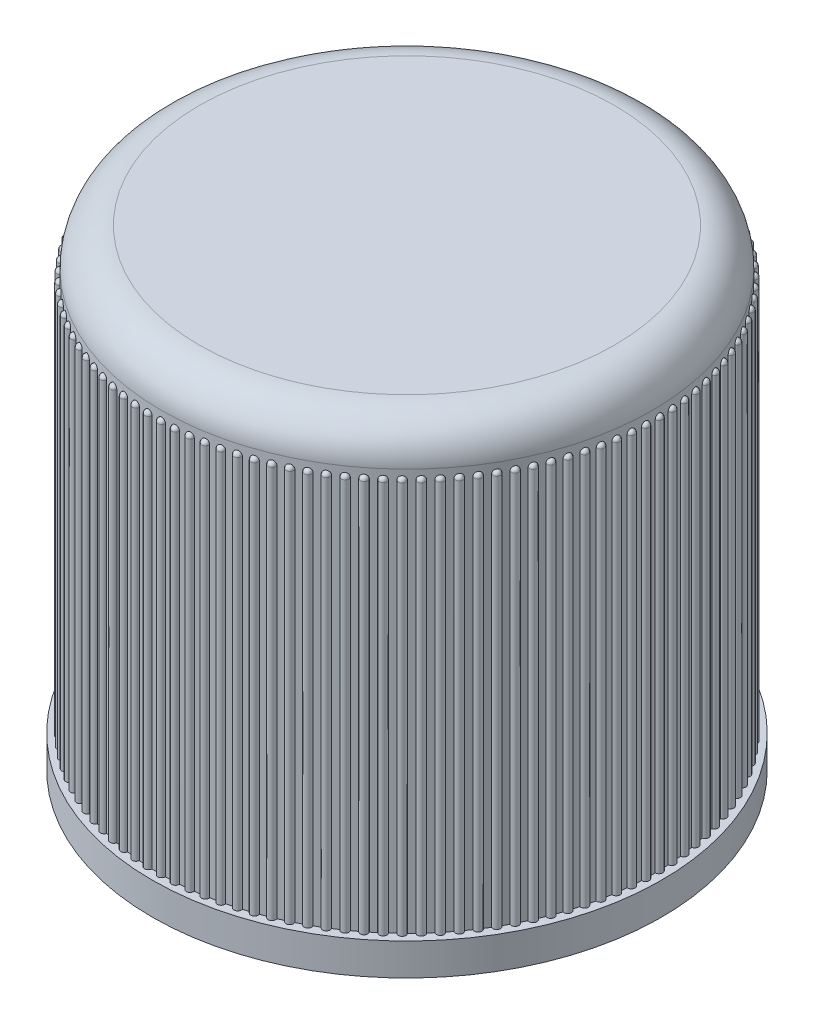
from build123d import *

# Parameters (mm, degrees)
SKETCH1_R                = 13.5
BOSS_EXTRUDE1_DEPTH      = 25
CUT_EXTRUDE1_START       = -23.3
SKETCH2_R                = 13.5
SKETCH2_R_2              = 13
CUT_EXTRUDE1_DEPTH       = 23.3
FILLET1_R                = 2
SHELL1_T                 = -0.5
BOSS_EXTRUDE3_START      = 1.2
SKETCH6_R                = 13.5
SKETCH6_R_2              = 12.5
BOSS_EXTRUDE3_DEPTH      = 1.2
SKETCH3_R                = 0.2
BOSS_EXTRUDE2_DEPTH      = 21
FILLET2_R                = 0.2
CIRPATTERN1_COUNT        = 114
FILLET2_OF_CIRPATTERN1_R = 0.2


with BuildPart() as part:
    # Sketch1 → Boss-Extrude1 (new body)
    with BuildSketch(Plane(origin=(0, 0, 0), x_dir=(1, 0, 0), z_dir=(0, 1, 0))):
        with Locations(Location((0, 0, 0), (0, 0, 270))):
            Circle(SKETCH1_R)
    extrude(amount=BOSS_EXTRUDE1_DEPTH)

    # Sketch2 → Cut-Extrude1 (cut)
    with BuildSketch(Plane(origin=(0, 25, 0), x_dir=(1, 0, 0), z_dir=(0, 1, 0)).offset(CUT_EXTRUDE1_START)):
        with Locations(Location((0, 0, 0), (0, 0, 270))):
            Circle(SKETCH2_R)
        with Locations(Location((0, 0, 0), (0, 0, 270))):
            Circle(SKETCH2_R_2, mode=Mode.SUBTRACT)
    extrude(amount=CUT_EXTRUDE1_DEPTH, mode=Mode.SUBTRACT)

    # Fillet1
    fillet1_edges = [part.edges().sort_by_distance(p)[0] for p in [
        (0, 25, -13),
    ]]
    fillet(fillet1_edges, radius=FILLET1_R)

    # Shell1
    shell1_openings = [part.faces().sort_by_distance(p)[0] for p in [
        (0, 0, 0),
    ]]
    offset(amount=SHELL1_T, openings=shell1_openings, kind=Kind.INTERSECTION)

    # Sketch6 → Boss-Extrude3 (add)
    with BuildSketch(Plane.XZ.offset(-1.2).offset(BOSS_EXTRUDE3_START)):
        with Locations(Location((0, 0, 0), (0, 0, 90))):
            Circle(SKETCH6_R)
        with Locations(Location((0, 0, 0), (0, 0, 90))):
            Circle(SKETCH6_R_2, mode=Mode.SUBTRACT)
    extrude(amount=-BOSS_EXTRUDE3_DEPTH)

    # Sketch3 → Boss-Extrude2 (add)
    with BuildSketch(Plane(origin=(0, 1.7, 0), x_dir=(1, 0, 0), z_dir=(0, 1, 0))):
        with Locations((0, -13)):
            Circle(SKETCH3_R)
    boss_extrude2 = extrude(amount=BOSS_EXTRUDE2_DEPTH)

    # Fillet2
    fillet2_edges = [part.edges().sort_by_distance(p)[0] for p in [
        (0, 22.7, 13.2),
    ]]
    fillet(fillet2_edges, radius=FILLET2_R - 0.0001)  # a hair under: the kernel refuses the full size

    # CirPattern1: Boss-Extrude2 ×114 about axis
    cirpattern1_axis = Axis((0, 0, 0), (0, 1, 0))
    for i in range(1, CIRPATTERN1_COUNT):
        add(boss_extrude2.rotate(cirpattern1_axis, i * 360 / CIRPATTERN1_COUNT))

    # Fillet2 of CirPattern1
    fillet2_of_cirpattern1_edges = [part.edges().sort_by_distance(p)[0] for p in [
        (0.727158437, 22.7, 13.179956017),
        (1.452108517, 22.7, 13.119884941),
        (2.172648592, 22.7, 13.019969205),
        (2.886590404, 22.7, 12.880512251),
        (3.591765736, 22.7, 12.701937604),
        (4.286032994, 22.7, 12.48478759),
        (4.96728371, 22.7, 12.229721687),
        (5.633448949, 22.7, 11.937514521),
        (6.282505588, 22.7, 11.609053516),
        (6.912482465, 22.7, 11.245336197),
        (7.521466359, 22.7, 10.847467161),
        (8.107607808, 22.7, 10.416654724),
        (8.669126717, 22.7, 9.954207249),
        (9.204317774, 22.7, 9.461529174),
        (9.711555621, 22.7, 8.940116745),
        (10.189299792, 22.7, 8.391553476),
        (10.636099395, 22.7, 7.817505335),
        (11.050597513, 22.7, 7.219715687),
        (11.43153533, 22.7, 6.6),
        (11.77775595, 22.7, 5.96024033),
        (12.088207912, 22.7, 5.302379605),
        (12.361948384, 22.7, 4.628415729),
        (12.598146025, 22.7, 3.940395505),
        (12.79608351, 22.7, 3.24040843),
        (12.955159711, 22.7, 2.530580341),
        (13.074891517, 22.7, 1.813066963),
        (13.154915308, 22.7, 1.09004736),
        (13.194988053, 22.7, 0.363717319),
        (13.194988053, 22.7, -0.363717319),
        (13.154915308, 22.7, -1.09004736),
        (13.074891517, 22.7, -1.813066963),
        (12.955159711, 22.7, -2.530580341),
        (12.79608351, 22.7, -3.24040843),
        (12.598146025, 22.7, -3.940395505),
        (12.361948384, 22.7, -4.628415729),
        (12.088207912, 22.7, -5.302379605),
        (11.77775595, 22.7, -5.96024033),
        (11.43153533, 22.7, -6.6),
        (11.050597513, 22.7, -7.219715687),
        (10.636099395, 22.7, -7.817505335),
        (10.189299792, 22.7, -8.391553476),
        (9.711555621, 22.7, -8.940116745),
        (9.204317774, 22.7, -9.461529174),
        (8.669126717, 22.7, -9.954207249),
        (8.107607808, 22.7, -10.416654724),
        (7.521466359, 22.7, -10.847467161),
        (6.912482465, 22.7, -11.245336197),
        (6.282505588, 22.7, -11.609053516),
        (5.633448949, 22.7, -11.937514521),
        (4.96728371, 22.7, -12.229721687),
        (4.286032994, 22.7, -12.48478759),
        (3.591765736, 22.7, -12.701937604),
        (2.886590404, 22.7, -12.880512251),
        (2.172648592, 22.7, -13.019969205),
        (1.452108517, 22.7, -13.119884941),
        (0.727158437, 22.7, -13.179956017),
        (0, 22.7, -13.2),
        (-0.727158437, 22.7, -13.179956017),
        (-1.452108517, 22.7, -13.119884941),
        (-2.172648592, 22.7, -13.019969205),
        (-2.886590404, 22.7, -12.880512251),
        (-3.591765736, 22.7, -12.701937604),
        (-4.286032994, 22.7, -12.48478759),
        (-4.96728371, 22.7, -12.229721687),
        (-5.633448949, 22.7, -11.937514521),
        (-6.282505588, 22.7, -11.609053516),
        (-6.912482465, 22.7, -11.245336197),
        (-7.521466359, 22.7, -10.847467161),
        (-8.107607808, 22.7, -10.416654724),
        (-8.669126717, 22.7, -9.954207249),
        (-9.204317774, 22.7, -9.461529174),
        (-9.711555621, 22.7, -8.940116745),
        (-10.189299792, 22.7, -8.391553476),
        (-10.636099395, 22.7, -7.817505335),
        (-11.050597513, 22.7, -7.219715687),
        (-11.43153533, 22.7, -6.6),
        (-11.77775595, 22.7, -5.96024033),
        (-12.088207912, 22.7, -5.302379605),
        (-12.361948384, 22.7, -4.628415729),
        (-12.598146025, 22.7, -3.940395505),
        (-12.79608351, 22.7, -3.24040843),
        (-12.955159711, 22.7, -2.530580341),
        (-13.074891517, 22.7, -1.813066963),
        (-13.154915308, 22.7, -1.09004736),
        (-13.194988053, 22.7, -0.363717319),
        (-13.194988053, 22.7, 0.363717319),
        (-13.154915308, 22.7, 1.09004736),
        (-13.074891517, 22.7, 1.813066963),
        (-12.955159711, 22.7, 2.530580341),
        (-12.79608351, 22.7, 3.24040843),
        (-12.598146025, 22.7, 3.940395505),
        (-12.361948384, 22.7, 4.628415729),
        (-12.088207912, 22.7, 5.302379605),
        (-11.77775595, 22.7, 5.96024033),
        (-11.43153533, 22.7, 6.6),
        (-11.050597513, 22.7, 7.219715687),
        (-10.636099395, 22.7, 7.817505335),
        (-10.189299792, 22.7, 8.391553476),
        (-9.711555621, 22.7, 8.940116745),
        (-9.204317774, 22.7, 9.461529174),
        (-8.669126717, 22.7, 9.954207249),
        (-8.107607808, 22.7, 10.416654724),
        (-7.521466359, 22.7, 10.847467161),
        (-6.912482465, 22.7, 11.245336197),
        (-6.282505588, 22.7, 11.609053516),
        (-5.633448949, 22.7, 11.937514521),
        (-4.96728371, 22.7, 12.229721687),
        (-4.286032994, 22.7, 12.48478759),
        (-3.591765736, 22.7, 12.701937604),
        (-2.886590404, 22.7, 12.880512251),
        (-2.172648592, 22.7, 13.019969205),
        (-1.452108517, 22.7, 13.119884941),
        (-0.727158437, 22.7, 13.179956017),
    ]]
    fillet(fillet2_of_cirpattern1_edges, radius=FILLET2_OF_CIRPATTERN1_R - 0.0001)  # a hair under: the kernel refuses the full size


solid = part.part
